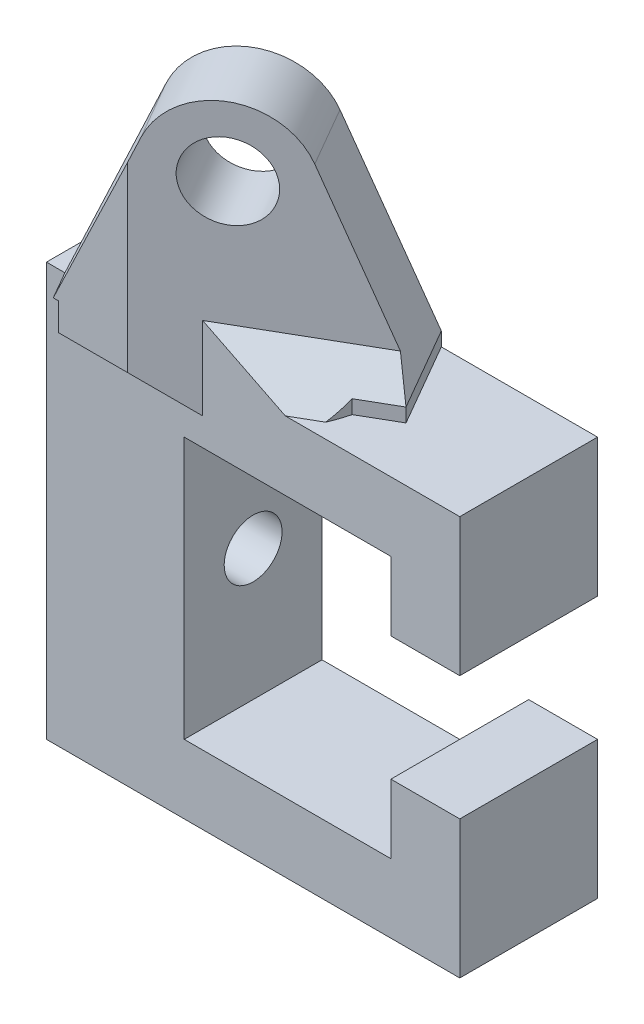
from build123d import *

# Parameters (mm, degrees)
BOSS_EXTRUDE1_DEPTH = 5
SKETCH2_R           = 2.1
CUT_EXTRUDE1_DEPTH  = 10
SKETCH3_R           = 10
BOSS_EXTRUDE2_DEPTH = 1
SKETCH4_R           = 2.75
BOSS_EXTRUDE3_DEPTH = 5
SKETCH5_W           = 50
SKETCH5_H           = 30
SKETCH5_W_2         = 34
SKETCH5_H_2         = 14
CUT_EXTRUDE2_DEPTH  = 52.14684741
CUT_EXTRUDE3_START  = -1
CUT_EXTRUDE3_DEPTH  = 1
CUT_EXTRUDE4_START  = -1
CUT_EXTRUDE4_DEPTH  = 1
CHAMFER1_SIZE       = 3
CHAMFER2_SIZE       = 3
BOSS_EXTRUDE4_DEPTH = 1
BOSS_EXTRUDE5_START = 1
BOSS_EXTRUDE5_DEPTH = 1


with BuildPart() as part:
    # Sketch1 → Boss-Extrude1 (new, symmetric)
    with BuildSketch(Plane.XY):
        Polygon((15, 5), (15, 0), (0, 0), (0, 19), (15, 19), (15, 14), (20, 14), (20, 24), (-10, 24), (-10, -5), (20, -5), (20, 5), align=None)
    extrude(amount=BOSS_EXTRUDE1_DEPTH, both=True)

    # Sketch2 → Cut-Extrude1 (cut)
    with BuildSketch(Plane.ZY.offset(10)):
        with Locations(Location((0, 9.5, 0), (0, 0, 270))):
            Circle(SKETCH2_R)
    extrude(amount=-CUT_EXTRUDE1_DEPTH, mode=Mode.SUBTRACT)

    # Sketch3 → Boss-Extrude2 (add)
    with BuildSketch(Plane(origin=(0, 24, 0), x_dir=(1, 0, 0), z_dir=(0, 1, 0))):
        with Locations(Location((0, 0, 0), (0, 0, 180))):
            Circle(SKETCH3_R)
    extrude(amount=BOSS_EXTRUDE2_DEPTH)

    # Sketch4 → Boss-Extrude3 (add)
    with BuildSketch(Plane(origin=(0, 0, 0), x_dir=(0.866025403784438, 0, -0.500000000000001), z_dir=(0.500000000000001, 0, 0.866025403784438))):
        with BuildLine():
            Line((10, 25), (-10, 25))
            Line((-10, 25), (-4.615384615, 37.923076923))
            ThreePointArc((-4.615384615, 37.923076923), (0, 41), (4.615384615, 37.923076923))
            Line((4.615384615, 37.923076923), (10, 25))
        make_face()
        with Locations((0, 36)):
            Circle(SKETCH4_R, mode=Mode.SUBTRACT)
    extrude(amount=BOSS_EXTRUDE3_DEPTH)

    # Sketch5 → Cut-Extrude2 (cut, through all)
    with BuildSketch(Plane.XZ.offset(5)):
        with Locations((5, 0)):
            Rectangle(SKETCH5_W, SKETCH5_H)
        with Locations((5, 0)):
            Rectangle(SKETCH5_W_2, SKETCH5_H_2, mode=Mode.SUBTRACT)
    extrude(amount=-CUT_EXTRUDE2_DEPTH, mode=Mode.SUBTRACT)

    # Sketch6 → Cut-Extrude3 (cut)
    with BuildSketch(Plane(origin=(0, 25, 0), x_dir=(1, 0, 0), z_dir=(0, 1, 0)).offset(CUT_EXTRUDE3_START)):
        with BuildLine():
            Line((7.141428429, 7), (-7.141428429, 7))
            ThreePointArc((-7.141428429, 7), (-9.920851384, 1.255670262), (-8.660254038, -5))
            Line((-8.660254038, -5), (8.660254038, 5))
            ThreePointArc((8.660254038, 5), (7.963874195, 6.047868038), (7.141428429, 7))
        make_face()
    extrude(amount=CUT_EXTRUDE3_DEPTH, mode=Mode.SUBTRACT)

    # Sketch7 → Cut-Extrude4 (cut)
    with BuildSketch(Plane(origin=(0, 25, 0), x_dir=(1, 0, 0), z_dir=(0, 1, 0)).offset(CUT_EXTRUDE4_START)):
        with BuildLine():
            Line((-2.124355653, -7), (7.141428429, -7))
            ThreePointArc((7.141428429, -7), (9.257815193, -3.780589618), (10, 0))
            Line((10, 0), (-2.124355653, -7))
        make_face()
    extrude(amount=CUT_EXTRUDE4_DEPTH, mode=Mode.SUBTRACT)

    # Chamfer1
    chamfer1_edges = [part.edges().sort_by_distance(p)[0] for p in [
        (5.669872981, 24, 2.5),
    ]]
    chamfer(chamfer1_edges, length=CHAMFER1_SIZE)

    # Chamfer2
    # the kernel refuses this chamfer: 3 mm, written as the material it adds along each edge
    with BuildSketch(Plane(origin=(9.054794926, 24, 5), x_dir=(0, -0.9996219169112968, -0.02749587661058648), z_dir=(-1, 0, 0))) as chamfer2_piece_1_section:
        Polygon((CHAMFER2_SIZE * 0.999621916911, CHAMFER2_SIZE * 0.0274958766106), (-CHAMFER2_SIZE * 0.0274958766106, CHAMFER2_SIZE * 0.999621916911), (0, 0), align=None)
    chamfer2_piece_1 = extrude(amount=25.430097928, mode=Mode.PRIVATE)
    chamfer2_piece_1 = split(chamfer2_piece_1, bisect_by=Plane(origin=(-3.023607394, 22.869371877, 7.519183235), z_dir=(-0.5000000000000006, 0, -0.8660254037844384)), keep=Keep.TOP, mode=Mode.PRIVATE)
    chamfer2_piece_1 = chamfer2_piece_1 & Plane(origin=(0, 22.869371877, 0), x_dir=(-1, 0, 0), z_dir=(0, -1, 0)) * Cylinder(10, 63, mode=Mode.PRIVATE)
    chamfer2_piece_1 = split(chamfer2_piece_1, bisect_by=Plane(origin=(-4.051544608, 22.869371877, 7), z_dir=(0, 0, -1)), keep=Keep.TOP, mode=Mode.PRIVATE)
    add(chamfer2_piece_1)

    # Sketch9 → Boss-Extrude4 (add)
    with BuildSketch(Plane(origin=(0, 24, 0), x_dir=(1, 0, 0), z_dir=(0, 1, 0))):
        Polygon((8.660254038, 5), (-10, 5), (-10, -5), (-8.660254038, -5), align=None)
    extrude(amount=BOSS_EXTRUDE4_DEPTH)

    # Sketch10 → Boss-Extrude5 (add)
    with BuildSketch(Plane.XZ.offset(-25).offset(BOSS_EXTRUDE5_START)):
        with BuildLine():
            Line((8.660254038, -5), (12.160254038, 1.062177826))
            Line((12.160254038, 1.062177826), (9.684658438, 2.491463612))
            ThreePointArc((9.684658438, 2.491463612), (9.907797949, -1.354820946), (8.660254038, -5))
        make_face()
    extrude(amount=-BOSS_EXTRUDE5_DEPTH)


solid = part.part
